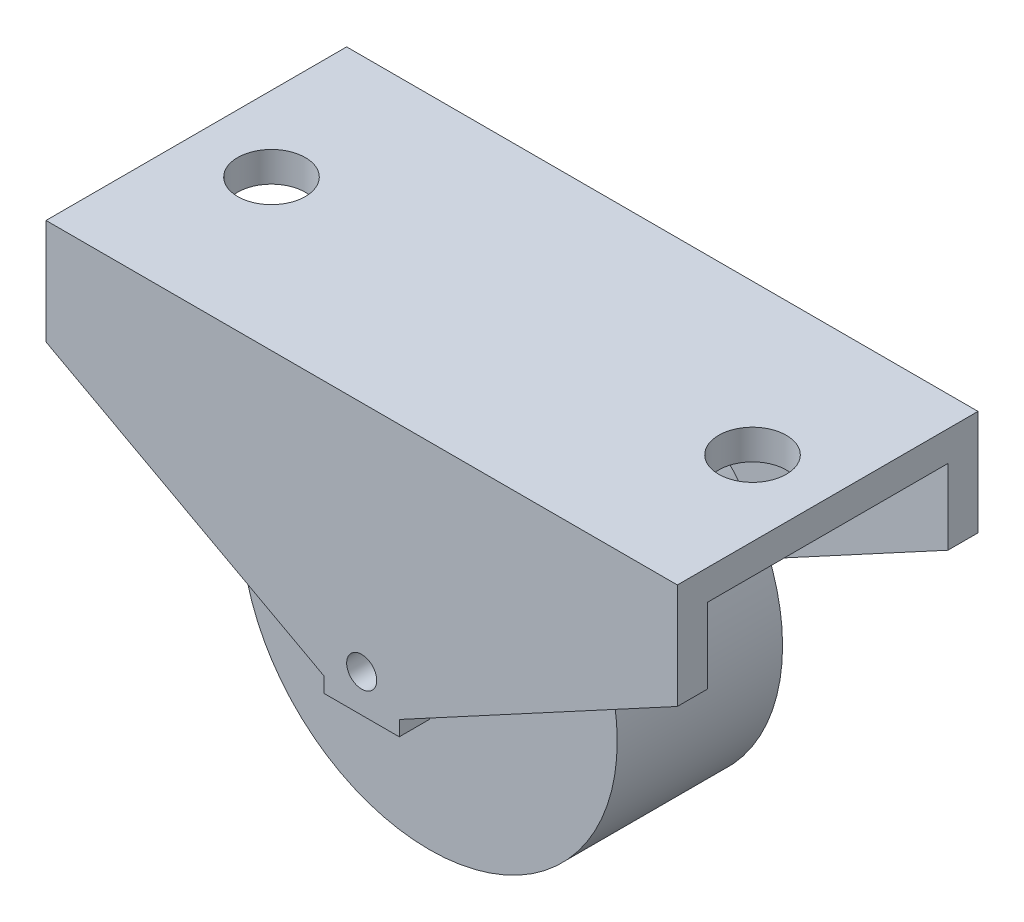
from build123d import *

# Parameters (mm, degrees)
SKETCH_1_W               = 42
SKETCH_1_H               = 20
SKETCH_1_R               = 2.25
EXTRUDE_1_DEPTH          = 2
EXTRUDE_START            = -5.5
SKETCH_2_R               = 12.5
EXTRUDE_2_DEPTH          = 11
EXTRUDE_3_DEPTH          = 2
PATTERN_LINEAR_1_COUNT   = 2
PATTERN_LINEAR_1_PITCH   = 18
CUT_EXTRUDE_1_DEPTH      = 38.960505792
CUT_EXTRUDE_1_DEPTH_BACK = 38.960505792
SKETCH_4_R               = 1


with BuildPart() as part:
    # Эскиз1 → Бобышка-Вытянуть1 (new body)
    with BuildSketch(Plane(origin=(0, 0, 0), x_dir=(1, 0, 0), z_dir=(0, 1, 0))):
        Rectangle(SKETCH_1_W, SKETCH_1_H)
        with Locations((-16, 0)):
            Circle(SKETCH_1_R, mode=Mode.SUBTRACT)
        with Locations((16, 0)):
            Circle(SKETCH_1_R, mode=Mode.SUBTRACT)
    extrude(amount=EXTRUDE_1_DEPTH)

    # Эскиз3 → Бобышка-Вытянуть3 (add)
    with BuildSketch(Plane.XY.offset(10)):
        Polygon((-21, -5), (-2.5, -15), (-2.5, -16), (2.5, -16), (2.5, -15), (21, -5), (21, 0), (-21, 0), align=None)
    extrude_3 = extrude(amount=-EXTRUDE_3_DEPTH)

    # Линейный массив1: Бобышка-Вытянуть3 ×2
    with Locations(*[(0, 0, -i * PATTERN_LINEAR_1_PITCH) for i in range(1, PATTERN_LINEAR_1_COUNT)]):
        add(extrude_3)

    # Эскиз4 → Вырез-Вытянуть1 (cut, two sides: drawn at the far end of the back side and taken through both)
    with BuildSketch(Plane.XY.offset(-8).offset(-CUT_EXTRUDE_1_DEPTH_BACK)):
        with Locations((0, -13.5)):
            Circle(SKETCH_4_R)
    extrude(amount=CUT_EXTRUDE_1_DEPTH + CUT_EXTRUDE_1_DEPTH_BACK, mode=Mode.SUBTRACT)


with BuildPart() as body_2:
    # Эскиз2 → Бобышка-Вытянуть2 (new body)
    with BuildSketch(Plane.XY.offset(EXTRUDE_START)):
        with Locations((0, -13.5)):
            Circle(SKETCH_2_R)
    extrude(amount=EXTRUDE_2_DEPTH)


solid = Compound([part.part, body_2.part])
